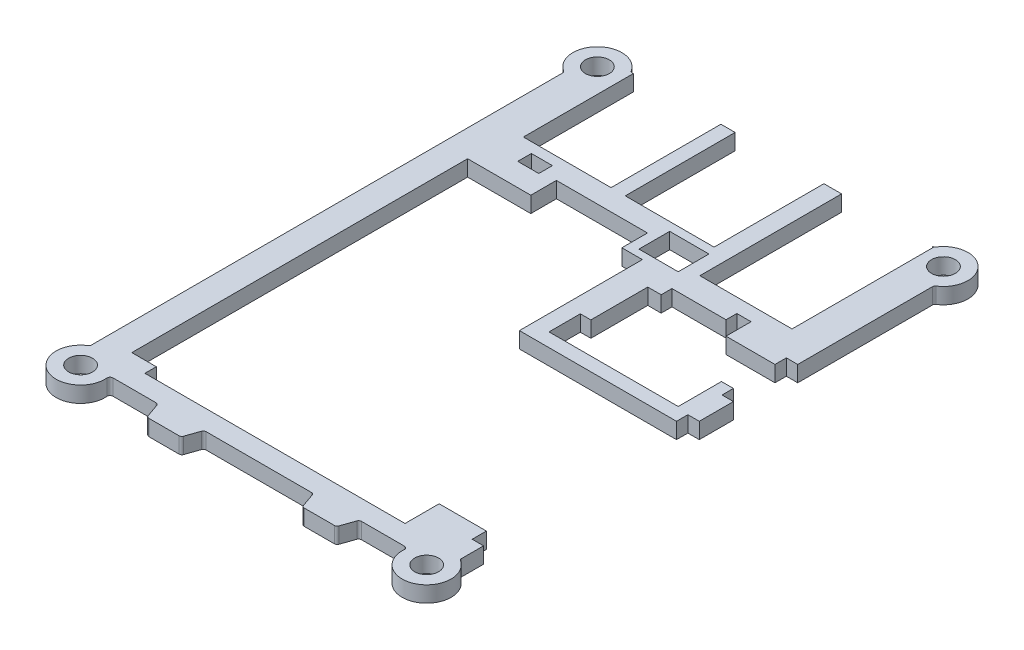
from build123d import *

# Parameters (mm, degrees)
BASEPLATE_OUTLINE_R = 2.1
BASEPLATE_DEPTH     = 2.8
CUT_EXTRUDE1_REACH  = 115.438
SKETCH3_W           = 15.4
SKETCH3_H           = 19.3
SKETCH3_W_2         = 15.6
SKETCH3_W_3         = 16.2
SKETCH3_H_2         = 24.9
SKETCH3_W_4         = 3.7
SKETCH3_H_3         = 2.4
CUT_EXTRUDE2_REACH  = 115.438
SKETCH4_W           = 6.9
SKETCH4_H           = 5.4


# Read off the part's stored shape, not the designer's step: BasePlate
with BuildPart() as part:
    # BasePlate outline → BasePlate (new body)
    with BuildSketch(Plane(origin=(0, 0, 0), x_dir=(1, 0, 0), z_dir=(0, 1, 0))):
        with BuildLine():
            Line((43.502626614, -5.852332608), (48.792614178, -5.852332608))
            ThreePointArc((48.792614178, -5.852332608), (49.082078508, -5.760021707), (49.264659986, -5.517174213))
            Line((49.264659986, -5.517174213), (50.078201202, -3.187491002))
            ThreePointArc((50.078201202, -3.187491002), (50.26078268, -2.944643509), (50.55024701, -2.852332608))
            Line((50.55024701, -2.852332608), (58.116695703, -2.852332608))
            ThreePointArc((58.116695703, -2.852332608), (58.484685739, -3.013831008), (58.614956567, -3.393999275))
            ThreePointArc((58.614956567, -3.393999275), (64.799237397, -7.61016844), (65.229166667, -0.137781095))
            ThreePointArc((65.229166667, -0.137781095), (65.061014427, 0.043158816), (65, 0.282515593))
            Line((65, 0.282515593), (65, 83.012819192))
            ThreePointArc((65, 83.012819192), (65.061014427, 83.252175969), (65.229166667, 83.433115879))
            ThreePointArc((65.229166667, 83.433115879), (65.940559159, 90.088226551), (59.285448487, 89.376834059))
            ThreePointArc((59.285448487, 89.376834059), (59.104508577, 89.208681819), (58.8651518, 89.147667392))
            Line((58.8651518, 89.147667392), (6.1348482, 89.147667392))
            ThreePointArc((6.1348482, 89.147667392), (5.895491423, 89.208681819), (5.714551513, 89.376834059))
            ThreePointArc((5.714551513, 89.376834059), (-0.940559159, 90.088226551), (-0.229166667, 83.433115879))
            ThreePointArc((-0.229166667, 83.433115879), (-0.061014427, 83.252175969), (0, 83.012819192))
            Line((0, 83.012819192), (0, 0.282515593))
            ThreePointArc((0, 0.282515593), (-0.061014427, 0.043158816), (-0.229166667, -0.137781095))
            ThreePointArc((-0.229166667, -0.137781095), (0.200762603, -7.61016844), (6.385043433, -3.393999275))
            ThreePointArc((6.385043433, -3.393999275), (6.515314261, -3.013831008), (6.883304297, -2.852332608))
            Line((6.883304297, -2.852332608), (14.44975299, -2.852332608))
            ThreePointArc((14.44975299, -2.852332608), (14.73921732, -2.944643509), (14.921798798, -3.187491002))
            Line((14.921798798, -3.187491002), (15.735340014, -5.517174213))
            ThreePointArc((15.735340014, -5.517174213), (15.917921492, -5.760021707), (16.207385822, -5.852332608))
            Line((16.207385822, -5.852332608), (21.497373386, -5.852332608))
            ThreePointArc((21.497373386, -5.852332608), (21.786837716, -5.760021707), (21.969419194, -5.517174213))
            Line((21.969419194, -5.517174213), (22.78296041, -3.187491002))
            ThreePointArc((22.78296041, -3.187491002), (22.965541888, -2.944643509), (23.255006218, -2.852332608))
            Line((23.255006218, -2.852332608), (41.744993782, -2.852332608))
            ThreePointArc((41.744993782, -2.852332608), (42.034458112, -2.944643509), (42.21703959, -3.187491002))
            Line((42.21703959, -3.187491002), (43.030580806, -5.517174213))
            ThreePointArc((43.030580806, -5.517174213), (43.213162284, -5.760021707), (43.502626614, -5.852332608))
        make_face()
        with Locations((2.1, -3.752332608)):
            Circle(BASEPLATE_OUTLINE_R, mode=Mode.SUBTRACT)
        with Locations((62.9, -3.752332608)):
            Circle(BASEPLATE_OUTLINE_R, mode=Mode.SUBTRACT)
        with Locations((2.1, 87.047667392)):
            Circle(BASEPLATE_OUTLINE_R, mode=Mode.SUBTRACT)
        with Locations((62.9, 87.047667392)):
            Circle(BASEPLATE_OUTLINE_R, mode=Mode.SUBTRACT)
    extrude(amount=BASEPLATE_DEPTH)

    # Sketch3 → Cut-Extrude1 (cut, up to next)
    with BuildSketch(Plane(origin=(0, 2.8, 0), x_dir=(1, 0, 0), z_dir=(0, 1, 0)), mode=Mode.PRIVATE) as cut_extrude1_sk1:
        Polygon((9, 0.647667392), (54.7, 0.647667392), (54.7, 6.647667392), (63, 6.647667392), (63, 4.147667392), (65, 4.147667392), (65, 42.047667392), (63, 42.047667392), (63, 40.047667392), (35.4, 40.047667392), (35.4, 61.647667392), (31.8, 61.647667392), (31.8, 66.147667392), (15.8, 66.147667392), (15.8, 61.647667392), (4.7, 61.647667392), (4.7, 2.647667392), (9, 2.647667392), align=None)
    cut_extrude1_tool1 = extrude(cut_extrude1_sk1.sketch, amount=-CUT_EXTRUDE1_REACH, mode=Mode.PRIVATE) & part.part
    # Sketch3 → Cut-Extrude1 (cut, up to next)
    with BuildSketch(Plane(origin=(0, 2.8, 0), x_dir=(1, 0, 0), z_dir=(0, 1, 0)), mode=Mode.PRIVATE) as cut_extrude1_sk2:
        with Locations((14, 79.497667392)):
            Rectangle(SKETCH3_W, SKETCH3_H)
    cut_extrude1_tool2 = extrude(cut_extrude1_sk2.sketch, amount=-CUT_EXTRUDE1_REACH, mode=Mode.PRIVATE) & part.part
    # Sketch3 → Cut-Extrude1 (cut, up to next)
    with BuildSketch(Plane(origin=(0, 2.8, 0), x_dir=(1, 0, 0), z_dir=(0, 1, 0)), mode=Mode.PRIVATE) as cut_extrude1_sk3:
        with Locations((32, 79.497667392)):
            Rectangle(SKETCH3_W_2, SKETCH3_H)
    cut_extrude1_tool3 = extrude(cut_extrude1_sk3.sketch, amount=-CUT_EXTRUDE1_REACH, mode=Mode.PRIVATE) & part.part
    # Sketch3 → Cut-Extrude1 (cut, up to next)
    with BuildSketch(Plane(origin=(0, 2.8, 0), x_dir=(1, 0, 0), z_dir=(0, 1, 0)), mode=Mode.PRIVATE) as cut_extrude1_sk4:
        with Locations((51, 76.697667392)):
            Rectangle(SKETCH3_W_3, SKETCH3_H_2)
    cut_extrude1_tool4 = extrude(cut_extrude1_sk4.sketch, amount=-CUT_EXTRUDE1_REACH, mode=Mode.PRIVATE) & part.part
    # Sketch3 → Cut-Extrude1 (cut, up to next)
    with BuildSketch(Plane(origin=(0, 2.8, 0), x_dir=(1, 0, 0), z_dir=(0, 1, 0)), mode=Mode.PRIVATE) as cut_extrude1_sk5:
        with Locations((11.35, 66.847667392)):
            Rectangle(SKETCH3_W_4, SKETCH3_H_3)
    cut_extrude1_tool5 = extrude(cut_extrude1_sk5.sketch, amount=-CUT_EXTRUDE1_REACH, mode=Mode.PRIVATE) & part.part
    add(cut_extrude1_tool1.solids().sort_by_distance((31.029219, 2.8, -28.401895))[0], mode=Mode.SUBTRACT)
    add(cut_extrude1_tool2.solids().sort_by_distance((14, 2.8, -79.497667))[0], mode=Mode.SUBTRACT)
    add(cut_extrude1_tool3.solids().sort_by_distance((32, 2.8, -79.497667))[0], mode=Mode.SUBTRACT)
    add(cut_extrude1_tool4.solids().sort_by_distance((51, 2.8, -76.697667))[0], mode=Mode.SUBTRACT)
    add(cut_extrude1_tool5.solids().sort_by_distance((11.35, 2.8, -66.847667))[0], mode=Mode.SUBTRACT)

    # Sketch4 → Cut-Extrude2 (cut, up to next)
    with BuildSketch(Plane(origin=(0, 2.8, 0), x_dir=(1, 0, 0), z_dir=(0, 1, 0)), mode=Mode.PRIVATE) as cut_extrude2_sk1:
        Polygon((65, 59.347667392), (63, 59.347667392), (63, 57.347667392), (54.4, 57.347667392), (54.4, 61.747667392), (51.9, 61.747667392), (51.9, 59.847667392), (42.4, 59.847667392), (42.4, 57.947667392), (40.05, 57.947667392), (40.05, 47.947667392), (38.2, 47.947667392), (38.2, 42.447667392), (60.9, 42.447667392), (60.9, 50.047667392), (63, 50.047667392), (63, 48.047667392), (65, 48.047667392), align=None)
    cut_extrude2_tool1 = extrude(cut_extrude2_sk1.sketch, amount=-CUT_EXTRUDE2_REACH, mode=Mode.PRIVATE) & part.part
    # Sketch4 → Cut-Extrude2 (cut, up to next)
    with BuildSketch(Plane(origin=(0, 2.8, 0), x_dir=(1, 0, 0), z_dir=(0, 1, 0)), mode=Mode.PRIVATE) as cut_extrude2_sk2:
        with Locations((36.95, 65.647667392)):
            Rectangle(SKETCH4_W, SKETCH4_H)
    cut_extrude2_tool2 = extrude(cut_extrude2_sk2.sketch, amount=-CUT_EXTRUDE2_REACH, mode=Mode.PRIVATE) & part.part
    add(cut_extrude2_tool1.solids().sort_by_distance((51.243501, 2.8, -50.961182))[0], mode=Mode.SUBTRACT)
    add(cut_extrude2_tool2.solids().sort_by_distance((36.95, 2.8, -65.647667))[0], mode=Mode.SUBTRACT)


solid = part.part
